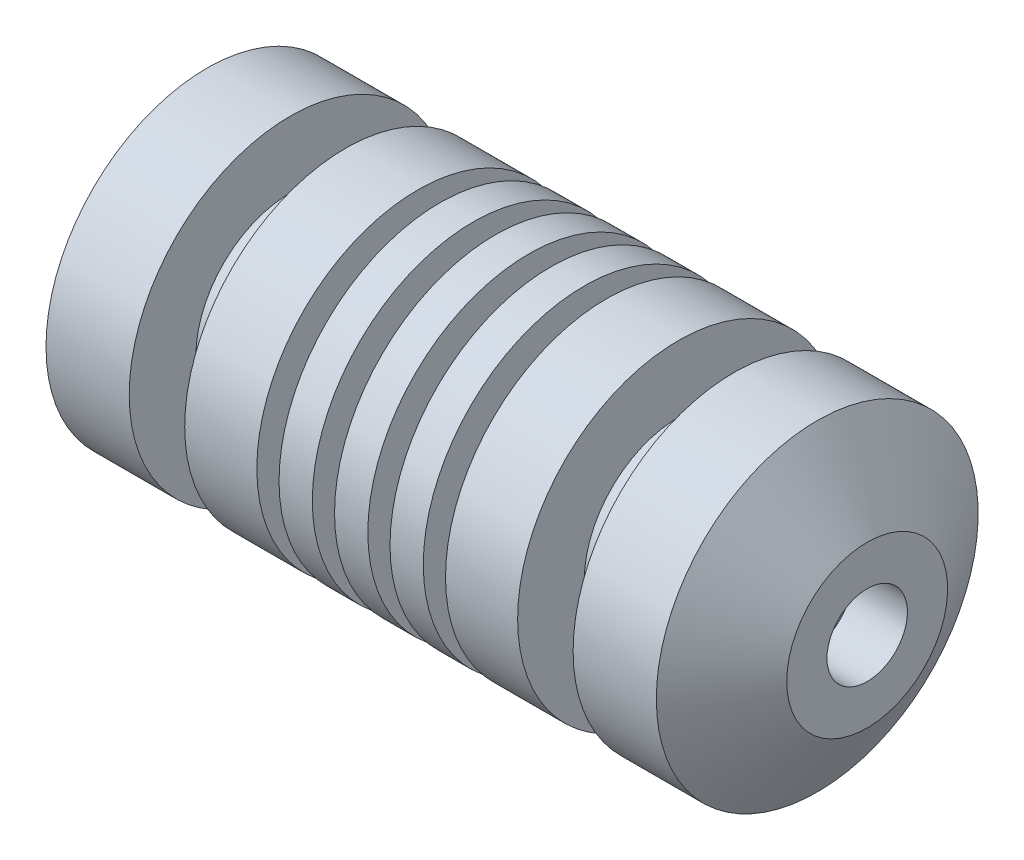
from build123d import *


with BuildPart() as part:
    # Sketch1 → Revolve5 (revolve)
    with BuildSketch(Plane.XY):
        Polygon((0, 0), (113.03, 0), (113.03, 3.81), (125.73, 3.81), (125.73, 6.35), (138.43, 6.35), (138.43, 9.2075), (151.13, 9.2075), (151.13, 18.415), (139.700007257, 36.83), (120.650007257, 36.83), (120.650007257, 21.59), (107.950007257, 21.59), (107.950007257, 36.83), (91.440007257, 36.83), (91.440007257, 29.21), (86.360007257, 29.21), (86.360007257, 36.83), (78.740007257, 36.83), (78.740007257, 29.21), (73.660007257, 29.21), (73.660007257, 36.83), (66.040007257, 36.83), (66.040007257, 29.21), (60.960007257, 29.21), (60.960007257, 36.83), (53.340007257, 36.83), (53.340007257, 29.21), (48.260007257, 29.21), (48.260007257, 36.83), (31.750007257, 36.83), (31.750007257, 21.59), (19.050007257, 21.59), (19.050007257, 36.83), (0, 36.83), align=None)
    revolve(axis=Axis((0, 0, 0), (1, 0, 0)))


solid = part.part
